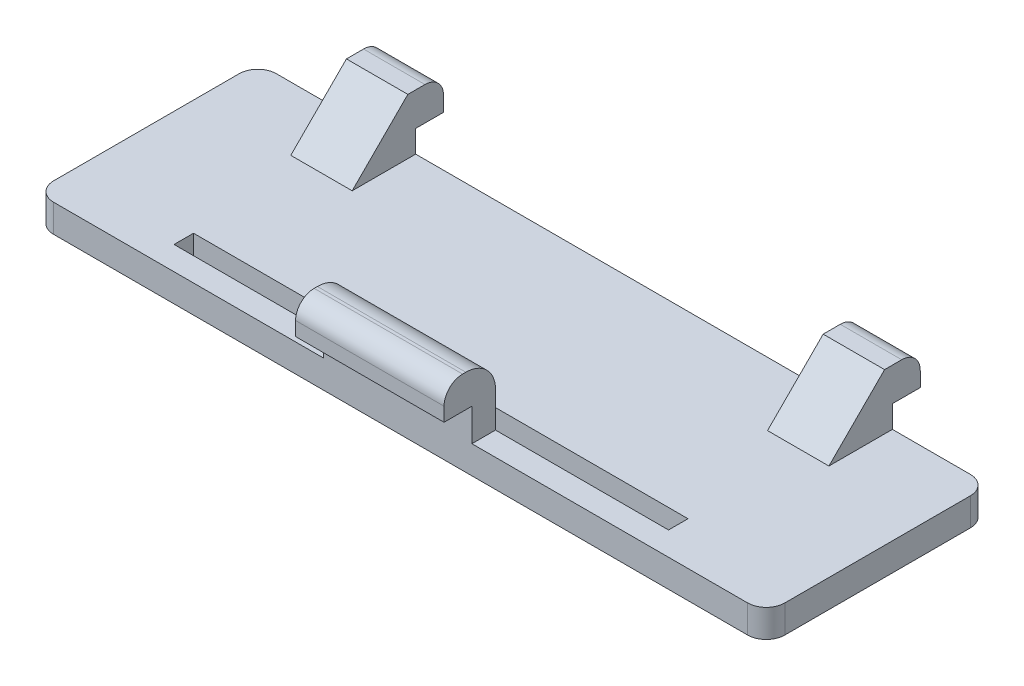
from build123d import *

# Parameters (mm, degrees)
SKETCH1_W                 = 3
SKETCH1_H                 = 1.629773482
SKETCH1_H_2               = 1.605700765
BOSS_EXTRUDE21_DEPTH      = 1.5
BOSS_EXTRUDE22_DEPTH      = 0.0001
BOSS_EXTRUDE22_DEPTH_BACK = 5
SKETCH4_W                 = 8
SKETCH4_H                 = 1.27322458
SKETCH5_W                 = 8
SKETCH5_H                 = 1.75
BOSS_EXTRUDE23_DEPTH      = 1.5
SKETCH6_W                 = 3.309716912
SKETCH6_H                 = 3.42211522
SKETCH6_W_2               = 3.309716913
BOSS_EXTRUDE24_DEPTH      = 3
SKETCH8_W                 = 3.309716912
SKETCH8_H                 = 1.8
SKETCH8_W_2               = 3.309716913
BOSS_EXTRUDE26_DEPTH      = 1.5
FILLET1_R                 = 1
FILLET2_R                 = 1
CHAMFER4_SIZE             = 3
FILLET3_R                 = 1.6


with BuildPart() as part:
    # Sketch1 → Boss-Extrude21 (new body)
    # profile 1 of 3: a face of its own
    with BuildSketch(Plane(origin=(0, 0, 0), x_dir=(1, 0, 0), z_dir=(0, 1, 0))):
        with Locations((14.277336143, -0.790814024)):
            Rectangle(SKETCH1_W, SKETCH1_H)
    # profile 2 of 3: a face of its own
    with BuildSketch(Plane(origin=(0, 0, 0), x_dir=(1, 0, 0), z_dir=(0, 1, 0))):
        Polygon((-2.384327038, -10.702702703), (-11.708098218, -10.702702703), (-11.708098218, -9.652730884), (14.939444142, -9.652730884), (14.939444142, -10.702702703), (5.615672962, -10.702702703), (5.615672962, -11.975927283), (21.477336143, -11.975927283), (21.477336143, 0.024072717), (15.777336143, 0.024072717), (15.777336143, -1.605700765), (12.777336143, -1.605700765), (12.777336143, 0.024072717), (-17.922663857, 0.024072717), (-17.922663857, -11.975927283), (-2.384327038, -11.975927283), align=None)
        with Locations((-10.768292904, -0.870035762)):
            Rectangle(SKETCH1_W, SKETCH1_H_2, mode=Mode.SUBTRACT)
    # profile 3 of 3: a face of its own
    with BuildSketch(Plane(origin=(0, 0, 0), x_dir=(1, 0, 0), z_dir=(0, 1, 0))):
        with Locations((-10.768292904, -0.870035762)):
            Rectangle(SKETCH1_W, SKETCH1_H_2)
    extrude(amount=BOSS_EXTRUDE21_DEPTH)

    # Sketch4 → Boss-Extrude22 (add, two sides: drawn at the far end of the back side and taken through both)
    with BuildSketch(Plane.XZ.offset(-BOSS_EXTRUDE22_DEPTH_BACK)):
        with Locations((1.615672962, 11.339314993)):
            Rectangle(SKETCH4_W, SKETCH4_H)
    extrude(amount=BOSS_EXTRUDE22_DEPTH + BOSS_EXTRUDE22_DEPTH_BACK)

    # Sketch5 → Boss-Extrude23 (add)
    with BuildSketch(Plane.XY.offset(11.975927283)):
        with Locations((1.615672962, 4.125)):
            Rectangle(SKETCH5_W, SKETCH5_H)
    extrude(amount=BOSS_EXTRUDE23_DEPTH)

    # Sketch6 → Boss-Extrude24 (add)
    with BuildSketch(Plane(origin=(0, 1.5, 0), x_dir=(1, 0, 0), z_dir=(0, 1, 0))):
        with Locations((14.622477687, -1.686984893)):
            Rectangle(SKETCH6_W, SKETCH6_H)
        with Locations((-11.0678054, -1.686984893)):
            Rectangle(SKETCH6_W_2, SKETCH6_H)
    extrude(amount=BOSS_EXTRUDE24_DEPTH)

    # Sketch8 → Boss-Extrude26 (add)
    with BuildSketch(Plane(origin=(0, 0, -0.024072717), x_dir=(-1, 0, 0), z_dir=(0, 0, -1))):
        with Locations((-14.622477687, 3.6)):
            Rectangle(SKETCH8_W, SKETCH8_H)
        with Locations((11.0678054, 3.6)):
            Rectangle(SKETCH8_W_2, SKETCH8_H)
    extrude(amount=BOSS_EXTRUDE26_DEPTH)

    # Fillet1
    fillet1_edges = [part.edges().sort_by_distance(p)[0] for p in [
        (-11.0678054, 4.5, -1.524072717),
        (1.615672962, 5, 13.475927283),
        (14.622477687, 4.5, -1.524072717),
    ]]
    fillet(fillet1_edges, radius=FILLET1_R)

    # Fillet2
    fillet2_edges = [part.edges().sort_by_distance(p)[0] for p in [
        (21.477336143, 0.75, 11.975927283),
        (-17.922663857, 0.75, 11.975927283),
        (-17.922663857, 0.75, -0.024072717),
        (21.477336143, 0.75, -0.024072717),
    ]]
    fillet(fillet2_edges, radius=FILLET2_R)

    # Chamfer4
    chamfer4_edges = [part.edges().sort_by_distance(p)[0] for p in [
        (14.622477687, 4.5, 3.398042503),
        (-11.0678054, 4.5, 3.398042503),
    ]]
    chamfer(chamfer4_edges, length=CHAMFER4_SIZE - 0.0001)  # a hair under: the kernel refuses the full size

    # Fillet3
    fillet3_edges = [part.edges().sort_by_distance(p)[0] for p in [
        (1.615672962, 5, 10.702702703),
    ]]
    fillet(fillet3_edges, radius=FILLET3_R)


solid = part.part
